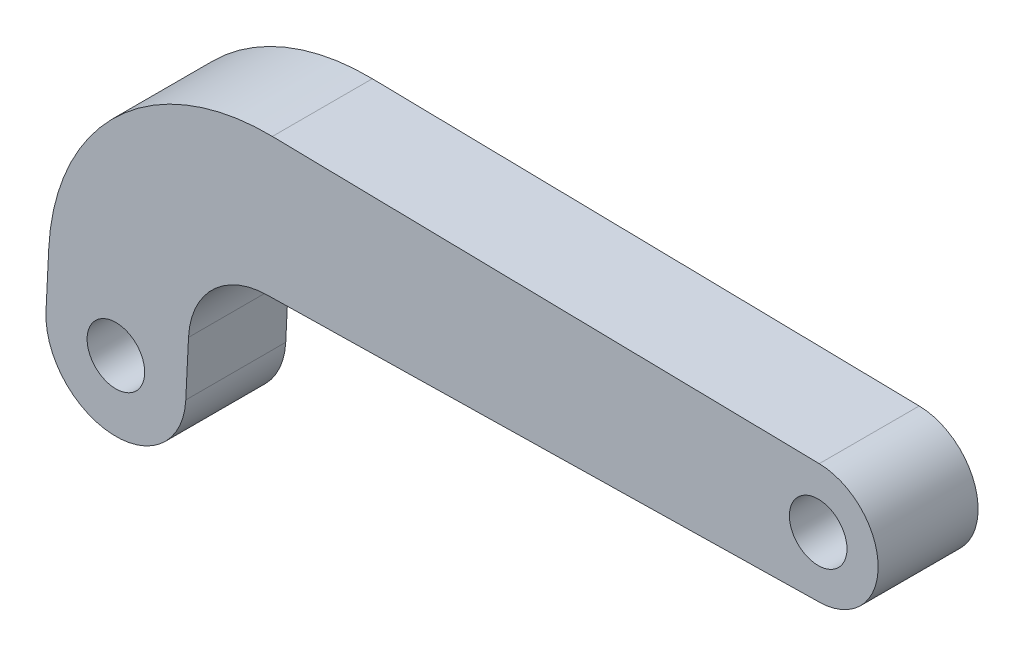
from build123d import *

# Parameters (mm, degrees)
SKETCH1_R           = 2.286
BOSS_EXTRUDE1_DEPTH = 3.96875


with BuildPart() as part:
    # Sketch1 → Boss-Extrude1 (new, symmetric)
    with BuildSketch(Plane.XY):
        with BuildLine():
            Line((55.852160303, 20.499543888), (12.426339018, 21.289226167))
            ThreePointArc((12.426339018, 21.289226167), (0.183355577, 16.585853064), (-5.332604413, 4.686838505))
            Line((-5.332604413, 4.686838505), (-5.549551288, 0.272753664))
            ThreePointArc((-5.549551288, 0.272753664), (-0.272753664, -5.549551288), (5.549551288, -0.272753664))
            Line((5.549551288, -0.272753664), (5.766498164, 4.141331178))
            ThreePointArc((5.766498164, 4.141331178), (7.688680768, 8.388633469), (11.993389211, 10.178563055))
            Line((11.993389211, 10.178563055), (55.852160303, 10.976118364))
            ThreePointArc((55.852160303, 10.976118364), (60.528070342, 15.737831126), (55.852160303, 20.499543888))
        make_face()
        Circle(SKETCH1_R, mode=Mode.SUBTRACT)
        with Locations((55.765570342, 15.737831126)):
            Circle(SKETCH1_R, mode=Mode.SUBTRACT)
    extrude(amount=BOSS_EXTRUDE1_DEPTH, both=True)


solid = part.part
